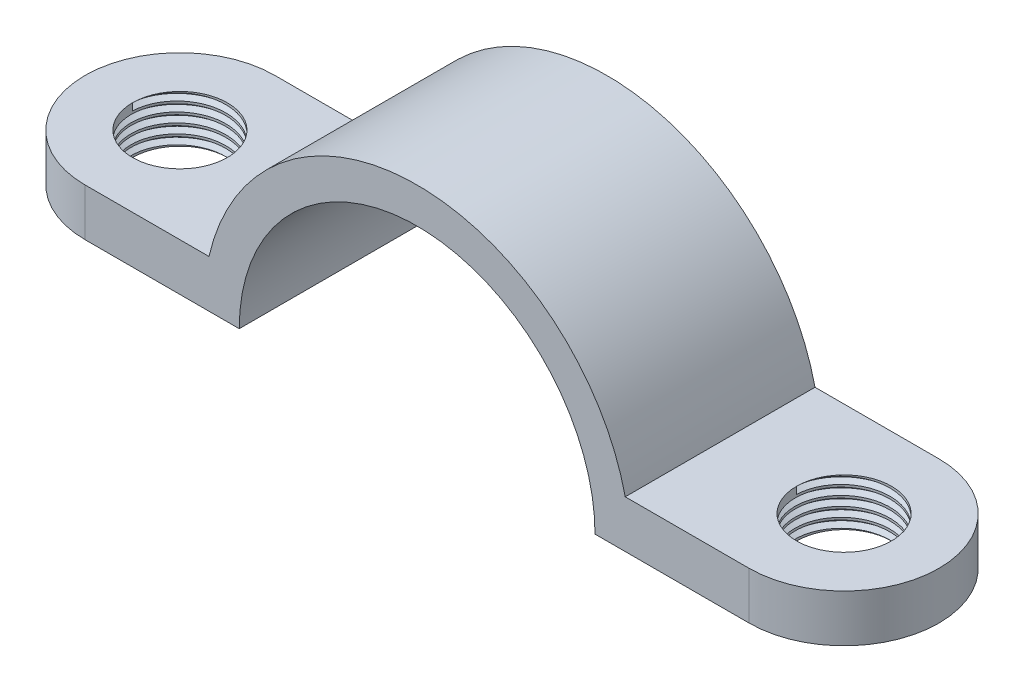
from build123d import *

# Parameters (mm, degrees)
SKETCH2_R           = 9
SKETCH2_R_2         = 7.5
BOSS_EXTRUDE1_DEPTH = 4
SKETCH3_R           = 2
BOSS_EXTRUDE2_DEPTH = 2
SKETCH4_W           = 29.723141141
SKETCH4_H           = 9.59553885
CUT_EXTRUDE2_DEPTH  = 5
THREAD2_PITCH       = 0.4
THREAD3_PITCH       = 0.4


with BuildPart() as part:
    # Sketch2 → Boss-Extrude1 (new, symmetric)
    with BuildSketch(Plane.XY):
        Circle(SKETCH2_R)
        Circle(SKETCH2_R_2, mode=Mode.SUBTRACT)
    extrude(amount=BOSS_EXTRUDE1_DEPTH, both=True)

    # Sketch3 → Boss-Extrude2 (add)
    with BuildSketch(Plane(origin=(0, 0, 0), x_dir=(1, 0, 0), z_dir=(0, 1, 0))):
        with BuildLine():
            ThreePointArc((14, 4), (18, 0), (14, -4))
            Line((14, -4), (9, -4))
            Line((9, -4), (7.5, -4))
            Line((7.5, -4), (7.5, 4))
            Line((7.5, 4), (9, 4))
            Line((9, 4), (14, 4))
        make_face()
        with Locations(Location((14, 0, 0), (0, 0, 270))):
            Circle(SKETCH3_R, mode=Mode.SUBTRACT)
    boss_extrude2 = extrude(amount=BOSS_EXTRUDE2_DEPTH)

    # Mirror1: Boss-Extrude2 across plane
    add(boss_extrude2.mirror(Plane(origin=(0, 0, 0), x_dir=(0, 0, 1), z_dir=(1, 0, 0))))

    # Sketch4 → Cut-Extrude2 (cut, symmetric)
    with BuildSketch(Plane.XY):
        with Locations((4.546058587, -4.797769425)):
            Rectangle(SKETCH4_W, SKETCH4_H)
    extrude(amount=CUT_EXTRUDE2_DEPTH, both=True, mode=Mode.SUBTRACT)

    # Thread2: the profile of Thread Profile2 profile screwed along a right-hand helix of 20 turns, 6 arcs to a turn; built about Z, then put on its axis
    thread2_z = Axis((0, 0, 0), (0, 0, 1))
    thread2_corners = [(1.9997, 0, -0.000173205), (2.21650635, 0, 0.124999999), (2.21650635, 0, 0.174999999), (1.9997, 0, 0.300173204)]
    with BuildLine(mode=Mode.PRIVATE) as thread2_profile:
        Line(thread2_corners[0], thread2_corners[1])
        Line(thread2_corners[1], thread2_corners[2])
        Line(thread2_corners[2], thread2_corners[3])
        Line(thread2_corners[3], thread2_corners[0])
    thread2_cap = Face(thread2_profile.wire())
    thread2_turn_angles = [0, 30, 60, 90, 120, 150, 180, 210, 240, 270, 300, 330, 360]
    thread2_turn_weights = [1, 0.8660254037844387, 1, 0.8660254037844387, 1, 0.8660254037844387, 1, 0.8660254037844387, 1, 0.8660254037844387, 1, 0.8660254037844387, 1]
    thread2_turn_rails = [Edge.make_bspline([Vector(p[0], p[1], 0).rotate(thread2_z, thread2_turn_angles[k]) / thread2_turn_weights[k] + Vector(0, 0, p[2] + THREAD2_PITCH * thread2_turn_angles[k] / 360) for k in range(13)], [0, 0, 0, 1, 1, 2, 2, 3, 3, 4, 4, 5, 5, 6, 6, 6], 2, thread2_turn_weights) for p in thread2_corners]
    thread2_turn_sides = [Face.make_surface_from_curves(thread2_turn_rails[p[0]], thread2_turn_rails[p[1]]) for p in [(0, 1), (1, 2), (2, 3), (3, 0)]]
    thread2 = Plane(origin=(-14, 2, 0), x_dir=(-1, 0, 0), z_dir=(0, -1, 0)) * Solid(Shell([*[p.moved(Location((0, 0, THREAD2_PITCH * i))) for i in range(20) for p in thread2_turn_sides], thread2_cap, thread2_cap.rotate(thread2_z, 7200).moved(Location((0, 0, THREAD2_PITCH * 7200 / 360)))]))
    add(thread2, mode=Mode.SUBTRACT)

    # Thread3: the profile of Thread Profile3 profile screwed along a right-hand helix of 20 turns, 6 arcs to a turn; built about Z, then put on its axis
    thread3_z = Axis((0, 0, 0), (0, 0, 1))
    thread3_corners = [(1.9997, 0, -0.000173205), (2.21650635, 0, 0.124999999), (2.21650635, 0, 0.174999999), (1.9997, 0, 0.300173204)]
    with BuildLine(mode=Mode.PRIVATE) as thread3_profile:
        Line(thread3_corners[0], thread3_corners[1])
        Line(thread3_corners[1], thread3_corners[2])
        Line(thread3_corners[2], thread3_corners[3])
        Line(thread3_corners[3], thread3_corners[0])
    thread3_cap = Face(thread3_profile.wire())
    thread3_turn_angles = [0, 30, 60, 90, 120, 150, 180, 210, 240, 270, 300, 330, 360]
    thread3_turn_weights = [1, 0.8660254037844387, 1, 0.8660254037844387, 1, 0.8660254037844387, 1, 0.8660254037844387, 1, 0.8660254037844387, 1, 0.8660254037844387, 1]
    thread3_turn_rails = [Edge.make_bspline([Vector(p[0], p[1], 0).rotate(thread3_z, thread3_turn_angles[k]) / thread3_turn_weights[k] + Vector(0, 0, p[2] + THREAD3_PITCH * thread3_turn_angles[k] / 360) for k in range(13)], [0, 0, 0, 1, 1, 2, 2, 3, 3, 4, 4, 5, 5, 6, 6, 6], 2, thread3_turn_weights) for p in thread3_corners]
    thread3_turn_sides = [Face.make_surface_from_curves(thread3_turn_rails[p[0]], thread3_turn_rails[p[1]]) for p in [(0, 1), (1, 2), (2, 3), (3, 0)]]
    thread3 = Plane(origin=(14, 2, 0), x_dir=(-1, 0, 0), z_dir=(0, -1, 0)) * Solid(Shell([*[p.moved(Location((0, 0, THREAD3_PITCH * i))) for i in range(20) for p in thread3_turn_sides], thread3_cap, thread3_cap.rotate(thread3_z, 7200).moved(Location((0, 0, THREAD3_PITCH * 7200 / 360)))]))
    add(thread3, mode=Mode.SUBTRACT)


solid = part.part
